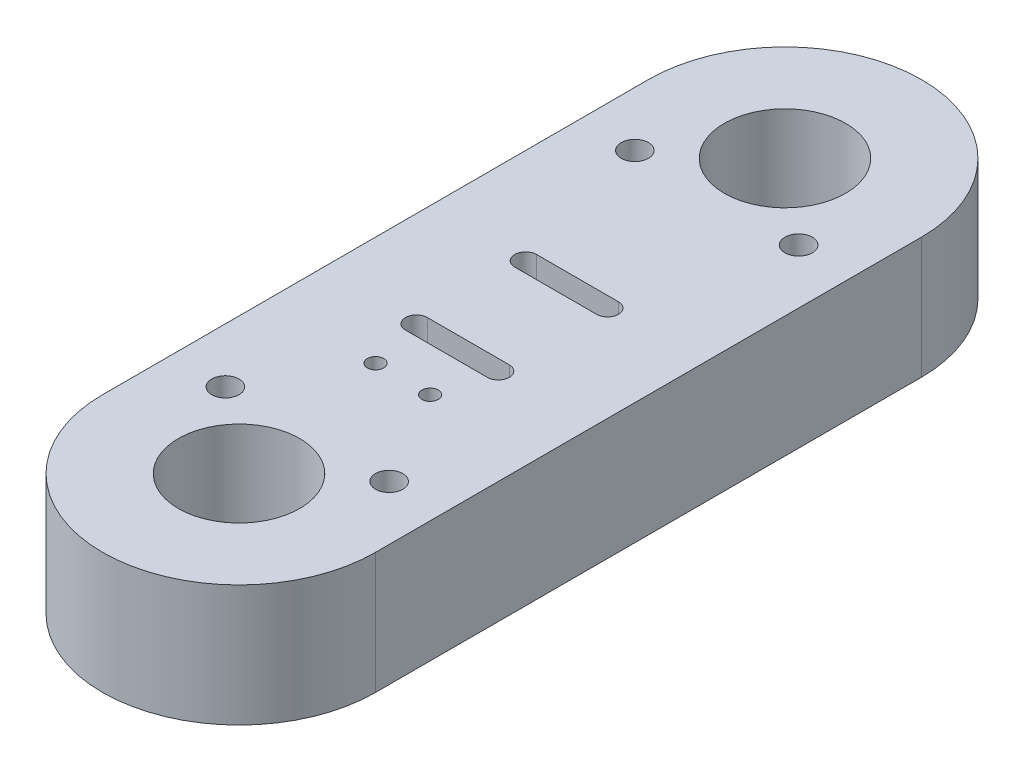
from build123d import *

# Parameters (mm, degrees)
SKETCH1_R           = 2.5
SKETCH1_R_2         = 1.5
SKETCH1_R_3         = 11.1125
BOSS_EXTRUDE1_DEPTH = 22.23


with BuildPart() as part:
    # Sketch1 → Boss-Extrude1 (new body)
    with BuildSketch(Plane(origin=(0, 0, 0), x_dir=(1, 0, 0), z_dir=(0, 1, 0))):
        with BuildLine():
            Line((-25, 50), (-25, -50))
            ThreePointArc((-25, -50), (0, -75), (25, -50))
            Line((25, -50), (25, 50))
            ThreePointArc((25, 50), (0, 75), (-25, 50))
        make_face()
        with Locations((-15, -37.5)):
            Circle(SKETCH1_R, mode=Mode.SUBTRACT)
        with Locations((-5, -20)):
            Circle(SKETCH1_R_2, mode=Mode.SUBTRACT)
        with BuildLine():
            Line((7.5, -12), (-7.5, -12))
            ThreePointArc((-7.5, -12), (-9.5, -10), (-7.5, -8))
            Line((-7.5, -8), (7.5, -8))
            ThreePointArc((7.5, -8), (9.5, -10), (7.5, -12))
        make_face(mode=Mode.SUBTRACT)
        with Locations((0, -50)):
            Circle(SKETCH1_R_3, mode=Mode.SUBTRACT)
        with Locations((15, -37.5)):
            Circle(SKETCH1_R, mode=Mode.SUBTRACT)
        with Locations((5, -20)):
            Circle(SKETCH1_R_2, mode=Mode.SUBTRACT)
        with Locations((-15, 37.5)):
            Circle(SKETCH1_R, mode=Mode.SUBTRACT)
        with BuildLine():
            ThreePointArc((-7.5, 8), (-9.5, 10), (-7.5, 12))
            Line((-7.5, 12), (7.5, 12))
            ThreePointArc((7.5, 12), (9.5, 10), (7.5, 8))
            Line((7.5, 8), (-7.5, 8))
        make_face(mode=Mode.SUBTRACT)
        with Locations((0, 50)):
            Circle(SKETCH1_R_3, mode=Mode.SUBTRACT)
        with Locations((15, 37.5)):
            Circle(SKETCH1_R, mode=Mode.SUBTRACT)
    extrude(amount=BOSS_EXTRUDE1_DEPTH)


solid = part.part
